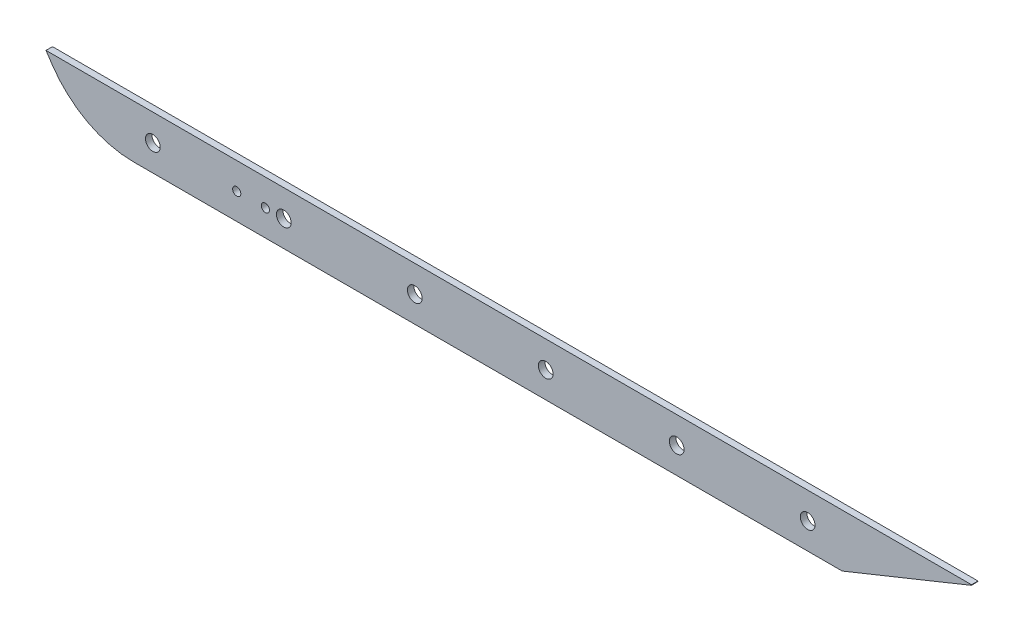
from build123d import *

# Parameters (mm, degrees)
BOSS_EXTRUDE1_DEPTH = 3.175
SKETCH1_4_R         = 3.6
CUT_EXTRUDE1_DEPTH  = 439.905857431
FILLET1_R           = 48
CUT_EXTRUDE3_DEPTH  = 10
CUT_EXTRUDE5_DEPTH  = 10
SKETCH13_R          = 2
CUT_EXTRUDE6_DEPTH  = 10


with BuildPart() as part:
    # Sketch1 → Boss-Extrude1 (new body)
    with BuildSketch(Plane.XY):
        Polygon((428.120588235, 28.939617947), (0.540381846, 28.939617947), (-115.605170134, 28.939617947), (-98.879411765, 3.850980392), (-31.879411765, -96.649019608), (366, -96.649019608), (403.120588235, -71.149019608), align=None)
    extrude(amount=BOSS_EXTRUDE1_DEPTH)

    # Sketch1<4> → Cut-Extrude1 (cut, through all)
    with BuildSketch(Plane.XY):
        with Locations((3.120588235, -83.899019608)):
            Circle(SKETCH1_4_R)
        with Locations((67.120588235, -83.899019608)):
            Circle(SKETCH1_4_R)
        with Locations((131.120588235, -83.899019608)):
            Circle(SKETCH1_4_R)
        with Locations((195.120588235, -83.899019608)):
            Circle(SKETCH1_4_R)
        with Locations((259.120588235, -83.899019608)):
            Circle(SKETCH1_4_R)
        with Locations((323.120588235, -83.899019608)):
            Circle(SKETCH1_4_R)
    extrude(amount=CUT_EXTRUDE1_DEPTH, mode=Mode.SUBTRACT)

    # Fillet1
    fillet1_edges = [part.edges().sort_by_distance(p)[0] for p in [
        (-31.879411765, -96.649019608, 1.5875),
    ]]
    fillet(fillet1_edges, radius=FILLET1_R)

    # Sketch7 → Cut-Extrude3 (cut)
    with BuildSketch(Plane.XY.offset(3.175)):
        Polygon((403.120588235, -71.149019608), (340.005873473, -96.649019608), (366, -96.649019608), align=None)
    extrude(amount=-CUT_EXTRUDE3_DEPTH, mode=Mode.SUBTRACT)

    # Sketch11 → Cut-Extrude5 (cut)
    with BuildSketch(Plane.XY.offset(3.175)):
        Polygon((-49.086078431, -70.839019608), (403.198019602, -70.839019608), (428.120588235, 28.939617947), (-115.605170134, 28.939617947), align=None)
    extrude(amount=-CUT_EXTRUDE5_DEPTH, mode=Mode.SUBTRACT)

    # Sketch13 → Cut-Extrude6 (cut)
    with BuildSketch(Plane(origin=(0, 0, 0), x_dir=(-1, 0, 0), z_dir=(0, 0, -1))):
        with Locations((-58.120593324, -83.886258845)):
            Circle(SKETCH13_R)
        with Locations((-44.120593324, -83.886258845)):
            Circle(SKETCH13_R)
    extrude(amount=-CUT_EXTRUDE6_DEPTH, mode=Mode.SUBTRACT)


solid = part.part
